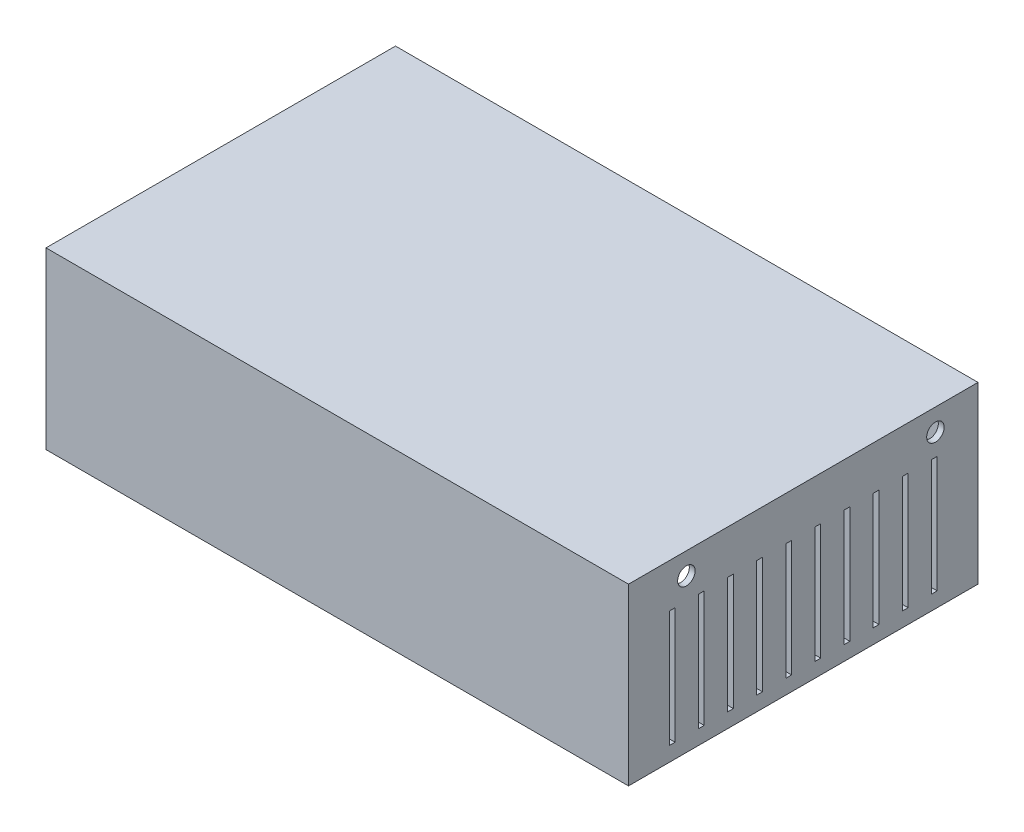
from build123d import *
from OCP.BRepAlgoAPI import BRepAlgoAPI_Cut
from OCP.TopTools import TopTools_ListOfShape

# Parameters (mm, degrees)
SKETCH2_W                 = 200
SKETCH2_H                 = 120
BOSS_EXTRUDE1_DEPTH       = 60
F_3_0MM_DOWEL_HOLE1_D     = 3
F_3_0MM_DOWEL_HOLE1_DEPTH = 20
F_3_0MM_DOWEL_HOLE1_TIP   = 0.901290929
SHELL23_DEPTH             = 58
SHELL23_START             = 21.131545056
SHELL23_2_DEPTH           = 36.868454944
SKETCH13_R                = 3
CUT_EXTRUDE5_DEPTH        = 10
SKETCH14_R                = 3
BOSS_EXTRUDE2_DEPTH       = 5
FILLET11_R                = 4
SKETCH15_R                = 3
SKETCH15_W                = 73.337485677
SKETCH15_H                = 23.643129711
CUT_EXTRUDE6_DEPTH        = 10
SKETCH16_W                = 2
SKETCH16_H                = 40
CUT_EXTRUDE7_DEPTH        = 10
LPATTERN1_COUNT           = 10
LPATTERN1_PITCH           = 10
SKETCH18_R                = 3
CUT_EXTRUDE8_DEPTH        = 10


with BuildPart() as part:
    # Sketch2 → Boss-Extrude1 (new body)
    with BuildSketch(Plane(origin=(0, 0, 0), x_dir=(1, 0, 0), z_dir=(0, 1, 0))):
        Rectangle(SKETCH2_W, SKETCH2_H)
    extrude(amount=BOSS_EXTRUDE1_DEPTH)

    # Ø3.0mm Dowel Hole1
    with Locations(Plane(origin=(-95, 0, 55), x_dir=(0, 0, -1), z_dir=(0, -1, 0))):
        with Locations((0, 0), (110, 0), (110, 190), (0, 190)):
            Hole(F_3_0MM_DOWEL_HOLE1_D / 2, depth=F_3_0MM_DOWEL_HOLE1_DEPTH)
            with Locations((0, 0, -(F_3_0MM_DOWEL_HOLE1_DEPTH + F_3_0MM_DOWEL_HOLE1_TIP / 2))):  # 118° drill point
                Cone(0, F_3_0MM_DOWEL_HOLE1_D / 2, F_3_0MM_DOWEL_HOLE1_TIP, mode=Mode.SUBTRACT)


with BuildPart() as shell23_tool:
    # Shell23: read off the stored shape, not the designer's step
    # Shell23 outline → Shell23 (new body)
    with BuildSketch(Plane(origin=(0, 0, 0), x_dir=(1, 0, 0), z_dir=(0, 1, 0))):
        with BuildLine():
            Line((-98, -58), (-96.802775638, -58))
            ThreePointArc((-96.802775638, -58), (-97.474873734, -57.474873734), (-98, -56.802775638))
            Line((-98, -56.802775638), (-98, -58))
        make_face()
        with BuildLine():
            ThreePointArc((-98, -53.197224362), (-92.525126266, -52.525126266), (-93.197224362, -58))
            Line((-93.197224362, -58), (93.197224362, -58))
            ThreePointArc((93.197224362, -58), (92.525126266, -52.525126266), (98, -53.197224362))
            Line((98, -53.197224362), (98, 53.197224362))
            ThreePointArc((98, 53.197224362), (92.525126266, 52.525126266), (93.197224362, 58))
            Line((93.197224362, 58), (-93.197224362, 58))
            ThreePointArc((-93.197224362, 58), (-92.525126266, 52.525126266), (-98, 53.197224362))
            Line((-98, 53.197224362), (-98, -53.197224362))
        make_face()
        with BuildLine():
            ThreePointArc((98, -56.802775638), (97.474873734, -57.474873734), (96.802775638, -58))
            Line((96.802775638, -58), (98, -58))
            Line((98, -58), (98, -56.802775638))
        make_face()
        with BuildLine():
            Line((-98, 58), (-98, 56.802775638))
            ThreePointArc((-98, 56.802775638), (-97.474873734, 57.474873734), (-96.802775638, 58))
            Line((-96.802775638, 58), (-98, 58))
        make_face()
        with BuildLine():
            ThreePointArc((96.802775638, 58), (97.474873734, 57.474873734), (98, 56.802775638))
            Line((98, 56.802775638), (98, 58))
            Line((98, 58), (96.802775638, 58))
        make_face()
    extrude(amount=SHELL23_DEPTH)


with BuildPart() as part_1:
    add(part.part)

    # Shell23: cut by shell23_tool, with a tolerance
    shell23_stock = TopTools_ListOfShape()
    shell23_stock.Append(part_1.part.wrapped)
    shell23_tools = TopTools_ListOfShape()
    shell23_tools.Append(shell23_tool.part.wrapped)
    shell23_cut = BRepAlgoAPI_Cut()
    shell23_cut.SetArguments(shell23_stock)
    shell23_cut.SetTools(shell23_tools)
    shell23_cut.SetFuzzyValue(0.00001)
    shell23_cut.Build()
    add(Compound.cast(shell23_cut.Shape()).solids(), mode=Mode.REPLACE)


with BuildPart() as shell23_2_tool:
    # Shell23 2 outline → Shell23 2 (new body)
    with BuildSketch(Plane(origin=(0, 0, 0), x_dir=(1, 0, 0), z_dir=(0, 1, 0)).offset(SHELL23_START)):
        with BuildLine():
            ThreePointArc((-98, -56.802775638), (-97.474873734, -57.474873734), (-96.802775638, -58))
            Line((-96.802775638, -58), (-93.197224362, -58))
            ThreePointArc((-93.197224362, -58), (-92.525126266, -52.525126266), (-98, -53.197224362))
            Line((-98, -53.197224362), (-98, -56.802775638))
        make_face()
        with BuildLine():
            ThreePointArc((98, -53.197224362), (92.525126266, -52.525126266), (93.197224362, -58))
            Line((93.197224362, -58), (96.802775638, -58))
            ThreePointArc((96.802775638, -58), (97.474873734, -57.474873734), (98, -56.802775638))
            Line((98, -56.802775638), (98, -53.197224362))
        make_face()
        with BuildLine():
            Line((-98, 56.802775638), (-98, 53.197224362))
            ThreePointArc((-98, 53.197224362), (-92.525126266, 52.525126266), (-93.197224362, 58))
            Line((-93.197224362, 58), (-96.802775638, 58))
            ThreePointArc((-96.802775638, 58), (-97.474873734, 57.474873734), (-98, 56.802775638))
        make_face()
        with BuildLine():
            ThreePointArc((93.197224362, 58), (92.525126266, 52.525126266), (98, 53.197224362))
            Line((98, 53.197224362), (98, 56.802775638))
            ThreePointArc((98, 56.802775638), (97.474873734, 57.474873734), (96.802775638, 58))
            Line((96.802775638, 58), (93.197224362, 58))
        make_face()
    extrude(amount=SHELL23_2_DEPTH)


with BuildPart() as part_2:
    add(part_1.part)

    # Shell23 2: cut by shell23_2_tool, with a tolerance
    shell23_2_stock = TopTools_ListOfShape()
    shell23_2_stock.Append(part_2.part.wrapped)
    shell23_2_tools = TopTools_ListOfShape()
    shell23_2_tools.Append(shell23_2_tool.part.wrapped)
    shell23_2_cut = BRepAlgoAPI_Cut()
    shell23_2_cut.SetArguments(shell23_2_stock)
    shell23_2_cut.SetTools(shell23_2_tools)
    shell23_2_cut.SetFuzzyValue(0.00001)
    shell23_2_cut.Build()
    add(Compound.cast(shell23_2_cut.Shape()).solids(), mode=Mode.REPLACE)


with BuildPart() as shell23_3_tool:
    # Shell23 3 outline → Shell23 3 (revolve)
    with BuildSketch(Plane(origin=(-95, 0, -55), x_dir=(1, 0, 0), z_dir=(0, 0, 1))):
        Polygon((3.50000013, 21.131545478), (0, 23.234557723), (0, 21.131545056), align=None)
    revolve(axis=Axis((-95, 0, -55), (0, 1, 0)))


with BuildPart() as part_3:
    add(part_2.part)


with BuildPart() as part_4:
    # Shell23 3: joined with shell23_3_tool
    add(part_3.part.fuse(shell23_3_tool.part, tol=0.00001))


with BuildPart() as shell23_4_tool:
    # Shell23 4 outline → Shell23 4 (revolve)
    with BuildSketch(Plane(origin=(-95, 0, 55), x_dir=(1, 0, 0), z_dir=(0, 0, 1))):
        Polygon((3.50000013, 21.131545478), (0, 23.234557723), (0, 21.131545056), align=None)
    revolve(axis=Axis((-95, 0, 55), (0, 1, 0)))


with BuildPart() as part_5:
    add(part_4.part)


with BuildPart() as part_6:
    # Shell23 4: joined with shell23_4_tool
    add(part_5.part.fuse(shell23_4_tool.part, tol=0.00001))


with BuildPart() as shell23_5_tool:
    # Shell23 5 outline → Shell23 5 (revolve)
    with BuildSketch(Plane(origin=(95, 0, -55), x_dir=(1, 0, 0), z_dir=(0, 0, 1))):
        Polygon((3.50000013, 21.131545478), (0, 23.234557723), (0, 21.131545056), align=None)
    revolve(axis=Axis((95, 0, -55), (0, 1, 0)))


with BuildPart() as part_7:
    add(part_6.part)


with BuildPart() as part_8:
    # Shell23 5: joined with shell23_5_tool
    add(part_7.part.fuse(shell23_5_tool.part, tol=0.00001))


with BuildPart() as shell23_6_tool:
    # Shell23 6 outline → Shell23 6 (revolve)
    with BuildSketch(Plane(origin=(95, 0, 55), x_dir=(1, 0, 0), z_dir=(0, 0, 1))):
        Polygon((3.50000013, 21.131545478), (0, 23.234557723), (0, 21.131545056), align=None)
    revolve(axis=Axis((95, 0, 55), (0, 1, 0)))


with BuildPart() as part_9:
    add(part_8.part)


with BuildPart() as part_10:
    # Shell23 6: joined with shell23_6_tool
    add(part_9.part.fuse(shell23_6_tool.part, tol=0.00001))

    # Sketch13 → Cut-Extrude5 (cut)
    with BuildSketch(Plane.ZY.offset(100)):
        with Locations((-30.891349638, 53.152115546)):
            Circle(SKETCH13_R)
        with Locations((41.77874675, 53.152115546)):
            Circle(SKETCH13_R)
    extrude(amount=-CUT_EXTRUDE5_DEPTH, mode=Mode.SUBTRACT)

    # Sketch14 → Boss-Extrude2 (add)
    with BuildSketch(Plane.XZ.offset(-58)):
        with Locations(Location((76.189917543, 49.080735978, 0), (0, 0, 270))):
            Circle(SKETCH14_R)
        with Locations(Location((76.189917543, -49.080735978, 0), (0, 0, 270))):
            Circle(SKETCH14_R)
        with Locations(Location((15.850126318, -49.080735978, 0), (0, 0, 270))):
            Circle(SKETCH14_R)
        with Locations(Location((11.040432815, 49.080735978, 0), (0, 0, 270))):
            Circle(SKETCH14_R)
        with Locations(Location((-42.522063019, 49.080735978, 0), (0, 0, 270))):
            Circle(SKETCH14_R)
        with Locations(Location((-42.522063019, -49.080735978, 0), (0, 0, 270))):
            Circle(SKETCH14_R)
    extrude(amount=BOSS_EXTRUDE2_DEPTH)

    # Fillet11
    fillet11_edges = [part_10.edges().sort_by_distance(p)[0] for p in [
        (-42.522063019, 58, -46.080735978),
        (76.189917543, 58, 52.080735978),
        (76.189917543, 58, -46.080735978),
        (15.850126318, 58, -46.080735978),
        (11.040432815, 58, 52.080735978),
        (-42.522063019, 58, 52.080735978),
    ]]
    fillet(fillet11_edges, radius=FILLET11_R)

    # Sketch15 → Cut-Extrude6 (cut)
    with BuildSketch(Plane(origin=(0, 0, -60), x_dir=(-1, 0, 0), z_dir=(0, 0, -1))):
        with Locations((46.95788262, 19.601401285)):
            Circle(SKETCH15_R)
        with Locations((-20.359361695, 19.601401285)):
            Rectangle(SKETCH15_W, SKETCH15_H)
    extrude(amount=-CUT_EXTRUDE6_DEPTH, mode=Mode.SUBTRACT)

    # Sketch16 → Cut-Extrude7 (cut)
    with BuildSketch(Plane(origin=(100, 0, 0), x_dir=(0, 0, -1), z_dir=(1, 0, 0))):
        with Locations((-45, 25)):
            Rectangle(SKETCH16_W, SKETCH16_H)
    cut_extrude7 = extrude(amount=-CUT_EXTRUDE7_DEPTH, mode=Mode.SUBTRACT)

    # LPattern1: Cut-Extrude7 ×10
    with Locations(*[(0, 0, -i * LPATTERN1_PITCH) for i in range(1, LPATTERN1_COUNT)]):
        add(cut_extrude7, mode=Mode.SUBTRACT)

    # Sketch18 → Cut-Extrude8 (cut)
    with BuildSketch(Plane(origin=(100, 0, 0), x_dir=(0, 0, -1), z_dir=(1, 0, 0))):
        with Locations((-40.127645148, 52.526648586)):
            Circle(SKETCH18_R)
        with Locations((45.381673973, 52.526648586)):
            Circle(SKETCH18_R)
    extrude(amount=-CUT_EXTRUDE8_DEPTH, mode=Mode.SUBTRACT)


solid = part_10.part
